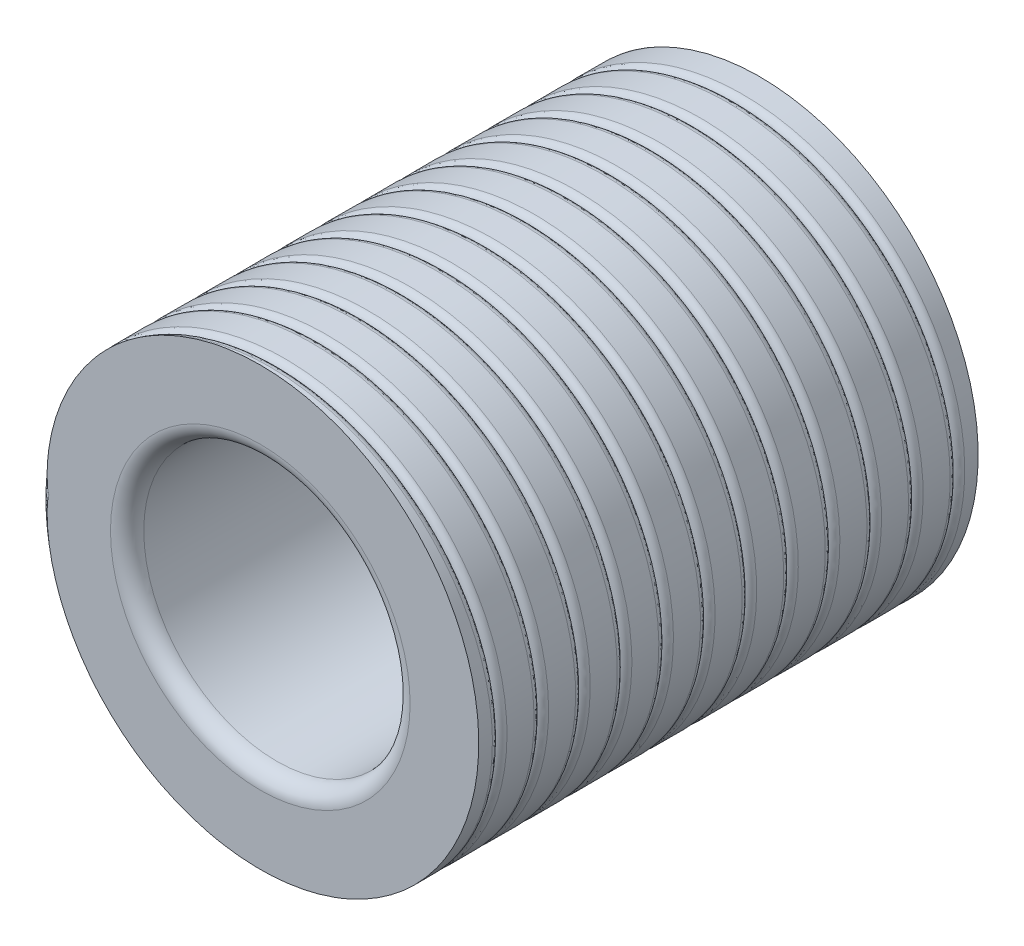
from build123d import *

# Parameters (mm, degrees)
SKETCH2_R           = 10.5
SKETCH2_R_2         = 6.4
BOSS_EXTRUDE1_DEPTH = 24
FILLET1_R           = 0.8
CUT_SWEEP1_PITCH    = 2


with BuildPart() as part:
    # Sketch2 → Boss-Extrude1 (new body)
    with BuildSketch(Plane.XY):
        Circle(SKETCH2_R)
        Circle(SKETCH2_R_2, mode=Mode.SUBTRACT)
    extrude(amount=BOSS_EXTRUDE1_DEPTH)

    # Fillet1
    fillet1_edges = [part.edges().sort_by_distance(p)[0] for p in [
        (-6.4, 0, 0),
        (-6.4, 0, 24),
    ]]
    fillet(fillet1_edges, radius=FILLET1_R)

    # Cut-Sweep1: arcs per turn and ends read off the stored shape
    # Cut-Sweep1: the profile of Sketch4 screwed along a right-hand helix through 13.6 turns, 10 arcs to a turn; built about Z, then put on its axis
    cut_sweep1_z = Axis((0, 0, 0), (0, 0, 1))
    cut_sweep1_corners = [(10.5, 0, -2), (10.5, 0, -1.65), (10.15, 0, -2), (10.5, 0, -2.35)]
    with BuildLine(mode=Mode.PRIVATE) as cut_sweep1_profile:
        Line(cut_sweep1_corners[0], cut_sweep1_corners[1])
        Line(cut_sweep1_corners[3], cut_sweep1_corners[0])
        ThreePointArc((10.5, 0, -1.65), (10.397487373, 0, -1.897487373), (10.15, 0, -2))
        ThreePointArc((10.15, 0, -2), (10.397487373, 0, -2.102512627), (10.5, 0, -2.35))
    cut_sweep1_cap = Face(cut_sweep1_profile.wire())
    cut_sweep1_arcs = [((10.5, 0, -1.65), (10.5, 0, -2), (10.15, 0, -2), (1, 0.707106781186526, 1)), ((10.15, 0, -2), (10.5, 0, -2), (10.5, 0, -2.35), (1, 0.7071067811865511, 1))]  # start, shoulder, end, weights
    cut_sweep1_turn_angles = [0, 18, 36, 54, 72, 90, 108, 126, 144, 162, 180, 198, 216, 234, 252, 270, 288, 306, 324, 342, 360]
    cut_sweep1_turn_weights = [1, 0.9510565162951535, 1, 0.9510565162951535, 1, 0.9510565162951535, 1, 0.9510565162951535, 1, 0.9510565162951535, 1, 0.9510565162951535, 1, 0.9510565162951535, 1, 0.9510565162951535, 1, 0.9510565162951535, 1, 0.9510565162951535, 1]
    cut_sweep1_turn_rails = [Edge.make_bspline([Vector(p[0], p[1], 0).rotate(cut_sweep1_z, cut_sweep1_turn_angles[k]) / cut_sweep1_turn_weights[k] + Vector(0, 0, p[2] + CUT_SWEEP1_PITCH * cut_sweep1_turn_angles[k] / 360) for k in range(21)], [0, 0, 0, 1, 1, 2, 2, 3, 3, 4, 4, 5, 5, 6, 6, 7, 7, 8, 8, 9, 9, 10, 10, 10], 2, cut_sweep1_turn_weights) for p in cut_sweep1_corners]
    cut_sweep1_turn_sides = [*[Face.make_surface_from_curves(cut_sweep1_turn_rails[p[0]], cut_sweep1_turn_rails[p[1]]) for p in [(0, 1), (3, 0)]], *[Face.make_bezier_surface([[Vector(p[j][0], p[j][1], 0).rotate(cut_sweep1_z, cut_sweep1_turn_angles[2 * i + k]) / cut_sweep1_turn_weights[2 * i + k] + Vector(0, 0, p[j][2] + CUT_SWEEP1_PITCH * cut_sweep1_turn_angles[2 * i + k] / 360) for k in range(3)] for j in range(3)], [[p[3][j] * cut_sweep1_turn_weights[2 * i + k] for k in range(3)] for j in range(3)]) for p in cut_sweep1_arcs for i in range(10)]]
    cut_sweep1_last_angles = [4680, 4698, 4716, 4734, 4752, 4770, 4788, 4806, 4824, 4842, 4860, 4878, 4896]
    cut_sweep1_last_weights = [1, 0.9510565162951535, 1, 0.9510565162951535, 1, 0.9510565162951535, 1, 0.9510565162951535, 1, 0.9510565162951535, 1, 0.9510565162951535, 1]
    cut_sweep1_last_rails = [Edge.make_bspline([Vector(p[0], p[1], 0).rotate(cut_sweep1_z, cut_sweep1_last_angles[k]) / cut_sweep1_last_weights[k] + Vector(0, 0, p[2] + CUT_SWEEP1_PITCH * cut_sweep1_last_angles[k] / 360) for k in range(13)], [0, 0, 0, 1, 1, 2, 2, 3, 3, 4, 4, 5, 5, 6, 6, 6], 2, cut_sweep1_last_weights) for p in cut_sweep1_corners]
    cut_sweep1_last_sides = [*[Face.make_surface_from_curves(cut_sweep1_last_rails[p[0]], cut_sweep1_last_rails[p[1]]) for p in [(0, 1), (3, 0)]], *[Face.make_bezier_surface([[Vector(p[j][0], p[j][1], 0).rotate(cut_sweep1_z, cut_sweep1_last_angles[2 * i + k]) / cut_sweep1_last_weights[2 * i + k] + Vector(0, 0, p[j][2] + CUT_SWEEP1_PITCH * cut_sweep1_last_angles[2 * i + k] / 360) for k in range(3)] for j in range(3)], [[p[3][j] * cut_sweep1_last_weights[2 * i + k] for k in range(3)] for j in range(3)]) for p in cut_sweep1_arcs for i in range(6)]]
    cut_sweep1 = Plane(origin=(0, 0, 24), x_dir=(-1, 0, 0), z_dir=(0, 0, -1)) * Solid(Shell([*[p.moved(Location((0, 0, CUT_SWEEP1_PITCH * i))) for i in range(13) for p in cut_sweep1_turn_sides], *cut_sweep1_last_sides, cut_sweep1_cap, cut_sweep1_cap.rotate(cut_sweep1_z, 4896).moved(Location((0, 0, CUT_SWEEP1_PITCH * 4896 / 360)))]))
    add(cut_sweep1, mode=Mode.SUBTRACT)


solid = part.part
